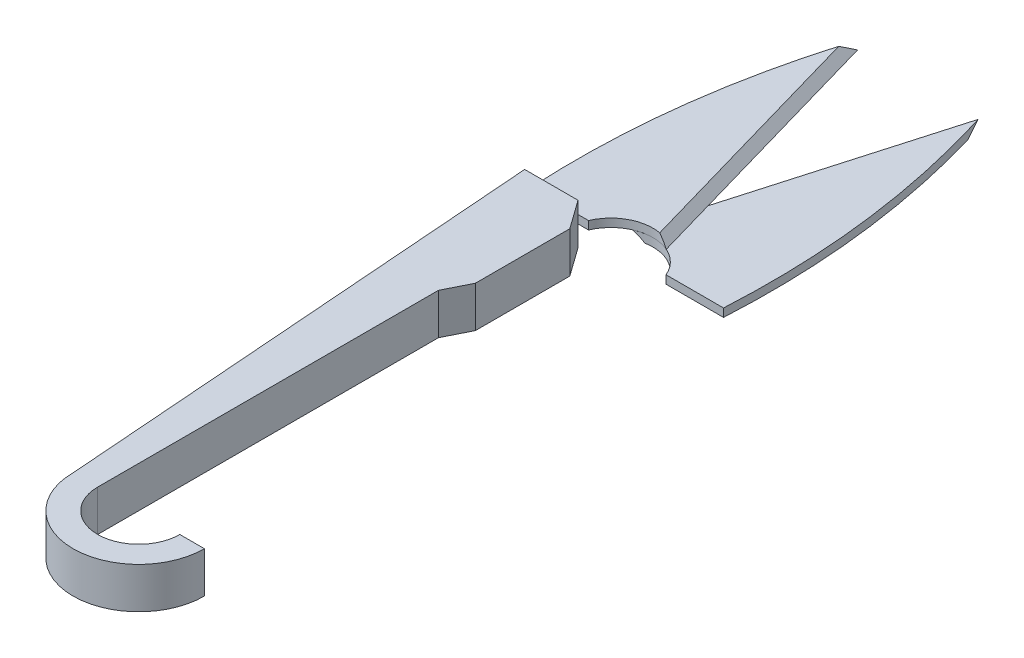
from build123d import *

# Parameters (mm, degrees)
BOSS_EXTRUDE1_DEPTH = 2.5
BOSS_EXTRUDE2_DEPTH = 1
BOSS_EXTRUDE3_DEPTH = 1
CHAMFER1_SIZE       = 1
CHAMFER2_SIZE       = 1


with BuildPart() as part:
    # Sketch1 → Boss-Extrude1 (new, symmetric)
    with BuildSketch(Plane(origin=(0, 0, 0), x_dir=(1, 0, 0), z_dir=(0, 1, 0))):
        with BuildLine():
            Line((-3.5, 11.5), (-6, 15))
            Line((-6, 15), (-12.5, 15))
            Line((-12.5, 15), (-8, -44.5))
            ThreePointArc((-8, -44.5), (-7.211102551, -41.035898385), (-5, -38.255002002))
            Line((-5, -38.255002002), (-5, -3))
            Line((-5, -3), (-3.5, 0))
            Line((-3.5, 0), (-3.5, 11.5))
        make_face()
        with BuildLine():
            Line((-5, -44.5), (-5, -38.255002002))
            ThreePointArc((-5, -38.255002002), (-7.211102551, -41.035898385), (-8, -44.5))
            ThreePointArc((-8, -44.5), (-5.656854249, -50.156854249), (0, -52.5))
            Line((0, -52.5), (0, -49.5))
            ThreePointArc((0, -49.5), (-3.535533906, -48.035533906), (-5, -44.5))
        make_face()
        with BuildLine():
            ThreePointArc((5, -44.5), (3.535533906, -48.035533906), (0, -49.5))
            Line((0, -49.5), (0, -52.5))
            ThreePointArc((0, -52.5), (5.656854249, -50.156854249), (8, -44.5))
            Line((8, -44.5), (5, -44.5))
        make_face()
    extrude(amount=BOSS_EXTRUDE1_DEPTH, both=True)


with BuildPart() as body_2:
    # Sketch3 → Boss-Extrude2 (new body)
    with BuildSketch(Plane(origin=(0, 0, 0), x_dir=(1, 0, 0), z_dir=(0, 1, 0))):
        with BuildLine():
            Line((0, 24.83548282), (-7.330228596, 50.379681687))
            add(Edge.make_bspline(
                [(-11.71864214, 15), (-12.72517251, 33.061648889), (-7.330228596, 50.379681687)],
                knots=[0, 0, 0, 1, 1, 1], degree=2))
            Line((-11.71864214, 15), (-4.71864214, 15))
            ThreePointArc((-4.71864214, 15), (-3.642426936, 16.605316859), (-2.048214886, 17.69791437))
            Line((-2.048214886, 17.69791437), (0, 24.83548282))
        make_face()
        with BuildLine():
            Line((2.048214886, 17.69791437), (0, 24.83548282))
            Line((0, 24.83548282), (-2.048214886, 17.69791437))
            ThreePointArc((-2.048214886, 17.69791437), (0, 18.124995965), (2.048214886, 17.69791437))
        make_face()
    extrude(amount=BOSS_EXTRUDE2_DEPTH)

    # Chamfer1
    chamfer1_edges = [body_2.edges().sort_by_distance(p)[0] for p in [
        (-2.641006855, 1, -34.038798028),
    ]]
    chamfer(chamfer1_edges, length=CHAMFER1_SIZE - 0.0001)  # a hair under: the kernel refuses the full size


with BuildPart() as body_3:
    # Sketch3<3> → Boss-Extrude3 (new body)
    with BuildSketch(Plane(origin=(0, 0, 0), x_dir=(1, 0, 0), z_dir=(0, 1, 0))):
        with BuildLine():
            Line((7.330228596, 50.379681687), (0, 24.83548282))
            Line((0, 24.83548282), (2.048214886, 17.69791437))
            ThreePointArc((2.048214886, 17.69791437), (3.642426936, 16.605316859), (4.71864214, 15))
            Line((4.71864214, 15), (11.71864214, 15))
            add(Edge.make_bspline(
                [(11.71864214, 15), (12.72517251, 33.061648889), (7.330228596, 50.379681687)],
                knots=[0, 0, 0, 1, 1, 1], degree=2))
        make_face()
        with BuildLine():
            Line((2.048214886, 17.69791437), (0, 24.83548282))
            Line((0, 24.83548282), (-2.048214886, 17.69791437))
            ThreePointArc((-2.048214886, 17.69791437), (0, 18.124995965), (2.048214886, 17.69791437))
        make_face()
    extrude(amount=-BOSS_EXTRUDE3_DEPTH)

    # Chamfer2
    chamfer2_edges = [body_3.edges().sort_by_distance(p)[0] for p in [
        (2.641006855, -1, -34.038798028),
    ]]
    chamfer(chamfer2_edges, length=CHAMFER2_SIZE - 0.0001)  # a hair under: the kernel refuses the full size


solid = Compound([part.part, body_2.part, body_3.part])
